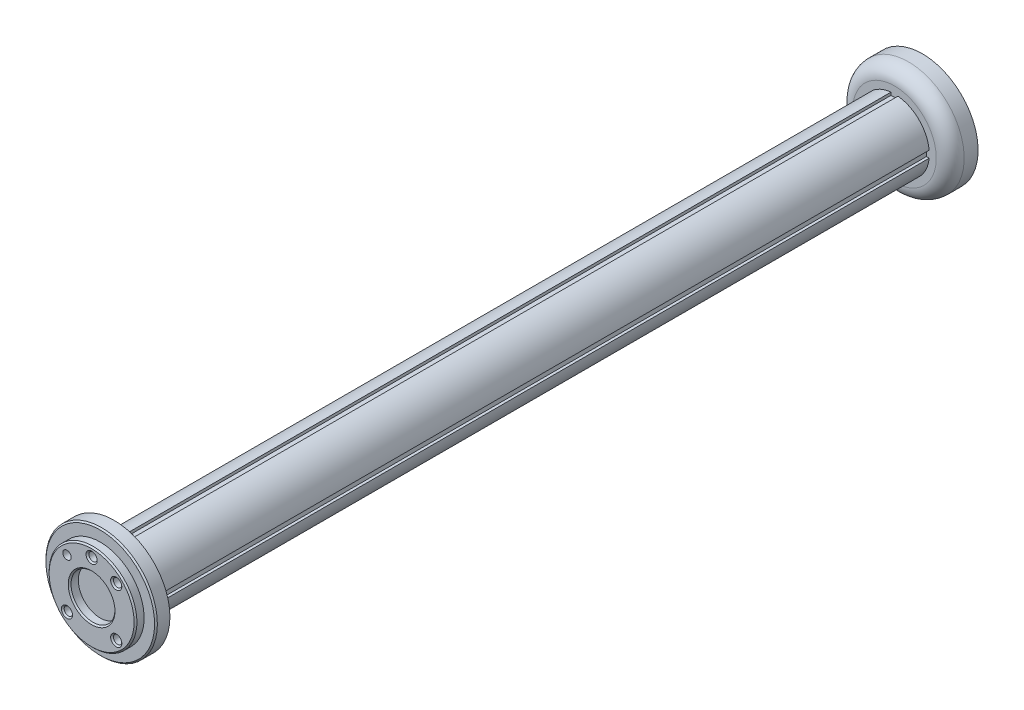
from build123d import *

# Parameters (mm, degrees)
AUFSATZ_LINEAR_AUSTRAGEN1_DEPTH = 100
AUFSATZ_LINEAR_START            = -460
AUFSATZ_LINEAR_AUSTRAGEN2_DEPTH = 460
SKIZZE2_R                       = 40
AUFSATZ_LINEAR_AUSTRAGEN3_DEPTH = 10
AUFSATZ_LINEAR_START_2          = 20
SKIZZE3_R                       = 40
AUFSATZ_LINEAR_AUSTRAGEN4_DEPTH = 20
SKIZZE4_R                       = 31.5
SKIZZE4_R_2                     = 15.75
SKIZZE4_R_3                     = 3
AUFSATZ_LINEAR_AUSTRAGEN5_DEPTH = 6.2
FASE1_SIZE                      = 1
VERRUNDUNG1_R                   = 10
WANDUNG8_START                  = -476
WANDUNG8_DEPTH                  = 582
WANDUNG8_2_OUTLINE_R            = 36
WANDUNG8_2_DEPTH                = 5.9999999
WANDUNG8_START_2                = 104
WANDUNG8_3_OUTLINE_R            = 36
WANDUNG8_3_DEPTH                = 2
WANDUNG8_START_3                = 106
WANDUNG8_4_DEPTH                = 6.2
WANDUNG8_5_DEPTH                = 12


with BuildPart() as part:
    # Skizze1 → Aufsatz-Linear austragen1 (new body)
    with BuildSketch(Plane.XY):
        with BuildLine():
            Line((-15, 20), (-15, 5))
            Line((-15, 5), (-13, 5))
            Line((-13, 5), (-13, -5))
            Line((-13, -5), (-15, -5))
            Line((-15, -5), (-15, -20))
            ThreePointArc((-15, -20), (-9.083123952, -23.291561976), (-2.5, -24.874685928))
            Line((-2.5, -24.874685928), (-2.5, -22.874685928))
            Line((-2.5, -22.874685928), (2.5, -22.874685928))
            Line((2.5, -22.874685928), (2.5, -24.874685928))
            ThreePointArc((2.5, -24.874685928), (17.67766953, -17.67766953), (24.874685928, -2.5))
            Line((24.874685928, -2.5), (22.874685928, -2.5))
            Line((22.874685928, -2.5), (22.874685928, 2.5))
            Line((22.874685928, 2.5), (24.874685928, 2.5))
            ThreePointArc((24.874685928, 2.5), (17.67766953, 17.67766953), (2.5, 24.874685928))
            Line((2.5, 24.874685928), (2.5, 22.874685928))
            Line((2.5, 22.874685928), (-2.5, 22.874685928))
            Line((-2.5, 22.874685928), (-2.5, 24.874685928))
            ThreePointArc((-2.5, 24.874685928), (-9.083123952, 23.291561976), (-15, 20))
        make_face()
    extrude(amount=AUFSATZ_LINEAR_AUSTRAGEN1_DEPTH)

    # Skizze1<2> → Aufsatz-Linear austragen2 (add)
    with BuildSketch(Plane.XY.offset(AUFSATZ_LINEAR_START)):
        with BuildLine():
            Line((-15, 20), (-15, 5))
            Line((-15, 5), (-13, 5))
            Line((-13, 5), (-13, -5))
            Line((-13, -5), (-15, -5))
            Line((-15, -5), (-15, -20))
            ThreePointArc((-15, -20), (-9.083123952, -23.291561976), (-2.5, -24.874685928))
            Line((-2.5, -24.874685928), (-2.5, -22.874685928))
            Line((-2.5, -22.874685928), (2.5, -22.874685928))
            Line((2.5, -22.874685928), (2.5, -24.874685928))
            ThreePointArc((2.5, -24.874685928), (17.67766953, -17.67766953), (24.874685928, -2.5))
            Line((24.874685928, -2.5), (22.874685928, -2.5))
            Line((22.874685928, -2.5), (22.874685928, 2.5))
            Line((22.874685928, 2.5), (24.874685928, 2.5))
            ThreePointArc((24.874685928, 2.5), (17.67766953, 17.67766953), (2.5, 24.874685928))
            Line((2.5, 24.874685928), (2.5, 22.874685928))
            Line((2.5, 22.874685928), (-2.5, 22.874685928))
            Line((-2.5, 22.874685928), (-2.5, 24.874685928))
            ThreePointArc((-2.5, 24.874685928), (-9.083123952, 23.291561976), (-15, 20))
        make_face()
    extrude(amount=AUFSATZ_LINEAR_AUSTRAGEN2_DEPTH)

    # Skizze2 → Aufsatz-Linear austragen3 (add)
    with BuildSketch(Plane.XY.offset(100)):
        Circle(SKIZZE2_R)
    extrude(amount=AUFSATZ_LINEAR_AUSTRAGEN3_DEPTH)

    # Skizze3 → Aufsatz-Linear austragen4 (add)
    with BuildSketch(Plane(origin=(0, 0, -460), x_dir=(-1, 0, 0), z_dir=(0, 0, -1)).offset(AUFSATZ_LINEAR_START_2)):
        with Locations(Location((0, 0, 0), (0, 0, 180))):
            Circle(SKIZZE3_R)
    extrude(amount=-AUFSATZ_LINEAR_AUSTRAGEN4_DEPTH)

    # Skizze4 → Aufsatz-Linear austragen5 (add)
    with BuildSketch(Plane.XY.offset(110)):
        with Locations(Location((0, 0, 0), (0, 0, 180))):
            Circle(SKIZZE4_R)
        with Locations(Location((0, 0, 0), (0, 0, 180))):
            Circle(SKIZZE4_R_2, mode=Mode.SUBTRACT)
        with Locations(Location((0, 25, 0), (0, 0, 180))):
            Circle(SKIZZE4_R_3, mode=Mode.SUBTRACT)
        with Locations(Location((17.67766953, 17.67766953, 0), (0, 0, 180))):
            Circle(SKIZZE4_R_3, mode=Mode.SUBTRACT)
        with Locations(Location((17.67766953, -17.67766953, 0), (0, 0, 180))):
            Circle(SKIZZE4_R_3, mode=Mode.SUBTRACT)
        with Locations(Location((-17.67766953, -17.67766953, 0), (0, 0, 180))):
            Circle(SKIZZE4_R_3, mode=Mode.SUBTRACT)
        with Locations(Location((-17.67766953, 17.67766953, 0), (0, 0, 180))):
            Circle(SKIZZE4_R_3, mode=Mode.SUBTRACT)
    extrude(amount=AUFSATZ_LINEAR_AUSTRAGEN5_DEPTH)

    # Fase1
    fase1_edges = [part.edges().sort_by_distance(p)[0] for p in [
        (-40, 0, 110),
        (31.5, 0, 116.2),
        (15.75, 0, 116.2),
        (3, 25, 116.2),
        (20.67766953, 17.67766953, 116.2),
        (20.67766953, -17.67766953, 116.2),
        (-14.67766953, -17.67766953, 116.2),
    ]]
    chamfer(fase1_edges, length=FASE1_SIZE)

    # Verrundung1
    verrundung1_edges = [part.edges().sort_by_distance(p)[0] for p in [
        (-40, 0, -460),
    ]]
    fillet(verrundung1_edges, radius=VERRUNDUNG1_R)

    # Wandung8: read off the stored shape, not the designer's step
    # Wandung8 outline → Wandung8 (cut)
    with BuildSketch(Plane.XY.offset(WANDUNG8_START)):
        with BuildLine():
            ThreePointArc((-6.5, 19.968725548), (-8.811599685, 19.06189159), (-11, 17.88854382))
            Line((-11, 17.88854382), (-11, 9))
            Line((-11, 9), (-9, 9))
            Line((-9, 9), (-9, -9))
            Line((-9, -9), (-11, -9))
            Line((-11, -9), (-11, -17.88854382))
            ThreePointArc((-11, -17.88854382), (-8.811599685, -19.06189159), (-6.5, -19.968725548))
            Line((-6.5, -19.968725548), (-6.5, -18.874685928))
            Line((-6.5, -18.874685928), (6.5, -18.874685928))
            Line((6.5, -18.874685928), (6.5, -19.968725548))
            ThreePointArc((6.5, -19.968725548), (14.849242405, -14.849242405), (19.968725548, -6.5))
            Line((19.968725548, -6.5), (18.874685928, -6.5))
            Line((18.874685928, -6.5), (18.874685928, 6.5))
            Line((18.874685928, 6.5), (19.968725548, 6.5))
            ThreePointArc((19.968725548, 6.5), (14.849242405, 14.849242405), (6.5, 19.968725548))
            Line((6.5, 19.968725548), (6.5, 18.874685928))
            Line((6.5, 18.874685928), (-6.5, 18.874685928))
            Line((-6.5, 18.874685928), (-6.5, 19.968725548))
        make_face()
    extrude(amount=WANDUNG8_DEPTH, mode=Mode.SUBTRACT)

    # Wandung8 2 outline → Wandung8 2 (cut)
    with BuildSketch(Plane.XY.offset(WANDUNG8_START)):
        Circle(WANDUNG8_2_OUTLINE_R)
        with BuildLine():
            ThreePointArc((-11, 17.88854382), (-8.811599685, 19.06189159), (-6.5, 19.968725548))
            Line((-6.5, 19.968725548), (-6.5, 18.874685928))
            Line((-6.5, 18.874685928), (6.5, 18.874685928))
            Line((6.5, 18.874685928), (6.5, 19.968725548))
            ThreePointArc((6.5, 19.968725548), (14.849242405, 14.849242405), (19.968725548, 6.5))
            Line((19.968725548, 6.5), (18.874685928, 6.5))
            Line((18.874685928, 6.5), (18.874685928, -6.5))
            Line((18.874685928, -6.5), (19.968725548, -6.5))
            ThreePointArc((19.968725548, -6.5), (14.849242405, -14.849242405), (6.5, -19.968725548))
            Line((6.5, -19.968725548), (6.5, -18.874685928))
            Line((6.5, -18.874685928), (-6.5, -18.874685928))
            Line((-6.5, -18.874685928), (-6.5, -19.968725548))
            ThreePointArc((-6.5, -19.968725548), (-8.811599685, -19.06189159), (-11, -17.88854382))
            Line((-11, -17.88854382), (-11, -9))
            Line((-11, -9), (-9, -9))
            Line((-9, -9), (-9, 9))
            Line((-9, 9), (-11, 9))
            Line((-11, 9), (-11, 17.88854382))
        make_face(mode=Mode.SUBTRACT)
    extrude(amount=WANDUNG8_2_DEPTH, mode=Mode.SUBTRACT)

    # Wandung8 3 outline → Wandung8 3 (cut)
    with BuildSketch(Plane.XY.offset(WANDUNG8_START_2)):
        Circle(WANDUNG8_3_OUTLINE_R)
        with BuildLine():
            ThreePointArc((-11, 17.88854382), (-8.811599685, 19.06189159), (-6.5, 19.968725548))
            Line((-6.5, 19.968725548), (-6.5, 18.874685928))
            Line((-6.5, 18.874685928), (6.5, 18.874685928))
            Line((6.5, 18.874685928), (6.5, 19.968725548))
            ThreePointArc((6.5, 19.968725548), (14.849242405, 14.849242405), (19.968725548, 6.5))
            Line((19.968725548, 6.5), (18.874685928, 6.5))
            Line((18.874685928, 6.5), (18.874685928, -6.5))
            Line((18.874685928, -6.5), (19.968725548, -6.5))
            ThreePointArc((19.968725548, -6.5), (14.849242405, -14.849242405), (6.5, -19.968725548))
            Line((6.5, -19.968725548), (6.5, -18.874685928))
            Line((6.5, -18.874685928), (-6.5, -18.874685928))
            Line((-6.5, -18.874685928), (-6.5, -19.968725548))
            ThreePointArc((-6.5, -19.968725548), (-8.811599685, -19.06189159), (-11, -17.88854382))
            Line((-11, -17.88854382), (-11, -9))
            Line((-11, -9), (-9, -9))
            Line((-9, -9), (-9, 9))
            Line((-9, 9), (-11, 9))
            Line((-11, 9), (-11, 17.88854382))
        make_face(mode=Mode.SUBTRACT)
    extrude(amount=WANDUNG8_3_DEPTH, mode=Mode.SUBTRACT)

    # Wandung8 4 outline → Wandung8 4 (cut)
    with BuildSketch(Plane.XY.offset(WANDUNG8_START_3)):
        with BuildLine():
            ThreePointArc((-23.651991808, -14.029728561), (-20.601261764, -11.317433021), (-16.556301479, -10.768072313))
            ThreePointArc((-16.556301479, -10.768072313), (-19.75, 0), (-16.556301479, 10.768072313))
            ThreePointArc((-16.556301479, 10.768072313), (-20.601261764, 11.317433021), (-23.651991808, 14.029728561))
            ThreePointArc((-23.651991808, 14.029728561), (-27.5, 0), (-23.651991808, -14.029728561))
        make_face()
        with BuildLine():
            ThreePointArc((-10.768072313, 16.556301479), (-7.557997789, 18.246620767), (-4.092896094, 19.32125))
            ThreePointArc((-4.092896094, 19.32125), (-6.56465826, 22.569925529), (-6.803967593, 26.645))
            ThreePointArc((-6.803967593, 26.645), (-10.52379439, 25.406687144), (-14.029728561, 23.651991808))
            ThreePointArc((-14.029728561, 23.651991808), (-11.317433021, 20.601261764), (-10.768072313, 16.556301479))
        make_face()
        with BuildLine():
            ThreePointArc((10.768072313, 16.556301479), (11.317433021, 20.601261764), (14.029728561, 23.651991808))
            ThreePointArc((14.029728561, 23.651991808), (10.52379439, 25.406687144), (6.803967593, 26.645))
            ThreePointArc((6.803967593, 26.645), (6.56465826, 22.569925529), (4.092896094, 19.32125))
            ThreePointArc((4.092896094, 19.32125), (7.557997789, 18.246620767), (10.768072313, 16.556301479))
        make_face()
        with BuildLine():
            ThreePointArc((16.556301479, 10.768072313), (19.75, 0), (16.556301479, -10.768072313))
            ThreePointArc((16.556301479, -10.768072313), (20.601261764, -11.317433021), (23.651991808, -14.029728561))
            ThreePointArc((23.651991808, -14.029728561), (27.5, 0), (23.651991808, 14.029728561))
            ThreePointArc((23.651991808, 14.029728561), (20.601261764, 11.317433021), (16.556301479, 10.768072313))
        make_face()
        with BuildLine():
            ThreePointArc((-10.768072313, -16.556301479), (-11.317433021, -20.601261764), (-14.029728561, -23.651991808))
            ThreePointArc((-14.029728561, -23.651991808), (0, -27.5), (14.029728561, -23.651991808))
            ThreePointArc((14.029728561, -23.651991808), (11.317433021, -20.601261764), (10.768072313, -16.556301479))
            ThreePointArc((10.768072313, -16.556301479), (0, -19.75), (-10.768072313, -16.556301479))
        make_face()
    extrude(amount=WANDUNG8_4_DEPTH, mode=Mode.SUBTRACT)

    # Wandung8 5 outline → Wandung8 5 (cut)
    with BuildSketch(Plane.XY.offset(WANDUNG8_START)):
        with BuildLine():
            ThreePointArc((-23.651991808, -14.029728561), (-20.601261764, -11.317433021), (-16.556301479, -10.768072313))
            ThreePointArc((-16.556301479, -10.768072313), (-19.75, 0), (-16.556301479, 10.768072313))
            ThreePointArc((-16.556301479, 10.768072313), (-20.601261764, 11.317433021), (-23.651991808, 14.029728561))
            ThreePointArc((-23.651991808, 14.029728561), (-27.5, 0), (-23.651991808, -14.029728561))
        make_face()
        with BuildLine():
            Line((-6.5, 18.874685928), (-5.814527592, 18.874685928))
            ThreePointArc((-5.814527592, 18.874685928), (-4.958741361, 19.117358188), (-4.092896094, 19.32125))
            ThreePointArc((-4.092896094, 19.32125), (-6.56465826, 22.569925529), (-6.803967593, 26.645))
            ThreePointArc((-6.803967593, 26.645), (-10.52379439, 25.406687144), (-14.029728561, 23.651991808))
            ThreePointArc((-14.029728561, 23.651991808), (-11.672924804, 21.275313311), (-10.689017037, 18.076086822))
            ThreePointArc((-10.689017037, 18.076086822), (-8.646449966, 19.137369281), (-6.5, 19.968725548))
            Line((-6.5, 19.968725548), (-6.5, 18.874685928))
        make_face()
        with BuildLine():
            ThreePointArc((4.092896094, 19.32125), (4.958741361, 19.117358188), (5.814527592, 18.874685928))
            Line((5.814527592, 18.874685928), (6.5, 18.874685928))
            Line((6.5, 18.874685928), (6.5, 19.968725548))
            ThreePointArc((6.5, 19.968725548), (8.646449966, 19.137369281), (10.689017037, 18.076086822))
            ThreePointArc((10.689017037, 18.076086822), (11.672924804, 21.275313311), (14.029728561, 23.651991808))
            ThreePointArc((14.029728561, 23.651991808), (10.52379439, 25.406687144), (6.803967593, 26.645))
            ThreePointArc((6.803967593, 26.645), (6.56465826, 22.569925529), (4.092896094, 19.32125))
        make_face()
        with BuildLine():
            ThreePointArc((23.651991808, 14.029728561), (21.275313311, 11.672924804), (18.076086822, 10.689017037))
            ThreePointArc((18.076086822, 10.689017037), (19.137369281, 8.646449966), (19.968725548, 6.5))
            Line((19.968725548, 6.5), (18.874685928, 6.5))
            Line((18.874685928, 6.5), (18.874685928, -6.5))
            Line((18.874685928, -6.5), (19.968725548, -6.5))
            ThreePointArc((19.968725548, -6.5), (19.137369281, -8.646449966), (18.076086822, -10.689017037))
            ThreePointArc((18.076086822, -10.689017037), (21.275313311, -11.672924804), (23.651991808, -14.029728561))
            ThreePointArc((23.651991808, -14.029728561), (27.5, 0), (23.651991808, 14.029728561))
        make_face()
        with BuildLine():
            ThreePointArc((-6.5, -19.968725548), (-8.646449966, -19.137369281), (-10.689017037, -18.076086822))
            ThreePointArc((-10.689017037, -18.076086822), (-11.672924804, -21.275313311), (-14.029728561, -23.651991808))
            ThreePointArc((-14.029728561, -23.651991808), (0, -27.5), (14.029728561, -23.651991808))
            ThreePointArc((14.029728561, -23.651991808), (11.672924804, -21.275313311), (10.689017037, -18.076086822))
            ThreePointArc((10.689017037, -18.076086822), (8.646449966, -19.137369281), (6.5, -19.968725548))
            Line((6.5, -19.968725548), (6.5, -18.874685928))
            Line((6.5, -18.874685928), (-6.5, -18.874685928))
            Line((-6.5, -18.874685928), (-6.5, -19.968725548))
        make_face()
    extrude(amount=WANDUNG8_5_DEPTH, mode=Mode.SUBTRACT)

    # Wandung8 6 outline → Wandung8 6 (revolve, cut)
    with BuildSketch(Plane.XZ):
        with BuildLine():
            Line((9, -464), (9, -470.0000001))
            Line((9, -470.0000001), (36, -470))
            ThreePointArc((36, -470), (34.242640687, -465.757359313), (30, -464))
            Line((30, -464), (9, -464))
        make_face()
    revolve(axis=Axis((0, 0, 0), (0, 0, 1)), mode=Mode.SUBTRACT)


solid = part.part
